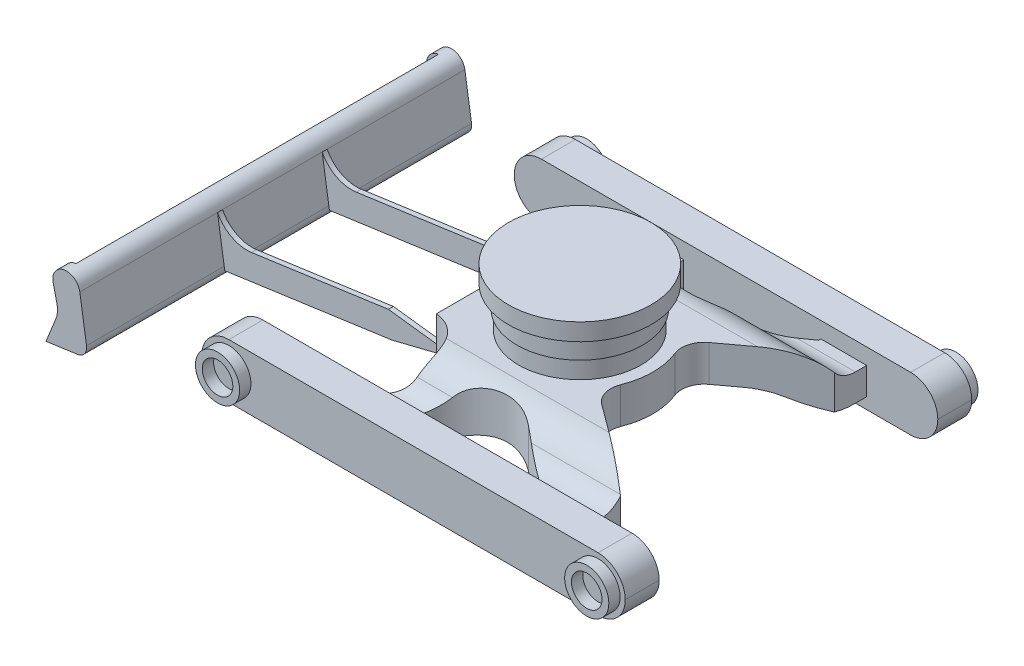
from build123d import *

# Parameters (mm, degrees)
BOSS_EXTRUDE1_DEPTH     = 125
CUT_EXTRUDE1_DEPTH      = 1988.3754049
CUT_EXTRUDE1_DEPTH_BACK = 1988.3754049
SKETCH2_OUTSIDE_W       = 1561.348
SKETCH2_OUTSIDE_H       = 581.348
BOSS_EXTRUDE2_START     = -162
SKETCH5_W               = 1870
SKETCH5_H               = 150
BOSS_EXTRUDE2_DEPTH     = 240
SKETCH6_R               = 97.5
SKETCH6_R_2             = 67.5
BOSS_EXTRUDE3_DEPTH     = 50
BOSS_EXTRUDE4_START     = 242
BOSS_EXTRUDE4_DEPTH     = 22
BOSS_EXTRUDE5_DEPTH     = 850
CUT_EXTRUDE2_DEPTH      = 800
FILLET1_R               = 120


with BuildPart() as part:
    # Sketch1 → Boss-Extrude1 (new, symmetric)
    with BuildSketch(Plane(origin=(0, 0, 0), x_dir=(1, 0, 0), z_dir=(0, 1, 0))):
        with BuildLine():
            Line((1556, 0), (1556, 143))
            Line((1556, 143), (1237.978629971, 378.323434848))
            ThreePointArc((1237.978629971, 378.323434848), (1201.290681935, 431.299496792), (1204.537119241, 495.657319277))
            ThreePointArc((1204.537119241, 495.657319277), (1227.393279461, 615), (1204.537119241, 734.342680723))
            ThreePointArc((1204.537119241, 734.342680723), (1201.290681935, 798.700503208), (1237.978629971, 851.676565152))
            Line((1237.978629971, 851.676565152), (1556, 1087))
            Line((1556, 1087), (1556, 1230))
            Line((1556, 1230), (1354, 1230))
            Line((1354, 1230), (1354, 1220))
            Line((1354, 1220), (1115.446796757, 1053.458774023))
            ThreePointArc((1115.446796757, 1053.458774023), (880.160611091, 1034.408386402), (748, 1230))
            Line((748, 1230), (490, 1230))
            Line((490, 1230), (490, 1220))
            ThreePointArc((490, 1220), (615.261987141, 1155.100386004), (665.520889463, 1023.280174895))
            ThreePointArc((665.520889463, 1023.280174895), (625.552350165, 919.777392468), (526.393279461, 870))
            Line((526.393279461, 870), (526.393279461, 360))
            ThreePointArc((526.393279461, 360), (625.552350165, 310.222607532), (665.520889463, 206.719825105))
            ThreePointArc((665.520889463, 206.719825105), (615.261987141, 74.899613996), (490, 10))
            Line((490, 10), (490, 0))
            Line((490, 0), (748, 0))
            ThreePointArc((748, 0), (880.160611091, 195.591613598), (1115.446796757, 176.541225977))
            Line((1115.446796757, 176.541225977), (1354, 10))
            Line((1354, 10), (1354, 0))
            Line((1354, 0), (1556, 0))
        make_face()
    extrude(amount=BOSS_EXTRUDE1_DEPTH, both=True)

    # Sketch2 outside → Cut-Extrude1 (cut, two sides: drawn at the far end of the back side and taken through both)
    with BuildSketch(Plane(origin=(0, 0, 0), x_dir=(0, 0, -1), z_dir=(1, 0, 0)).offset(-CUT_EXTRUDE1_DEPTH_BACK)):
        with Locations((615, 0)):
            Rectangle(SKETCH2_OUTSIDE_W, SKETCH2_OUTSIDE_H)
        with BuildLine():
            Line((287.306532047, 125), (942.693467953, 125))
            ThreePointArc((942.693467953, 125), (1021.812259611, 106.449731284), (1084.440322666, 54.665357377))
            ThreePointArc((1084.440322666, 54.665357377), (1126.66148877, 19.754543507), (1180, 7.248744372))
            Line((1180, 7.248744372), (1230, 7.248744372))
            Line((1230, 7.248744372), (1230, -112.751255628))
            Line((1230, -112.751255628), (1180, -112.751255628))
            ThreePointArc((1180, -112.751255628), (1082.973302732, -98.699147857), (993.919878018, -57.697571519))
            ThreePointArc((993.919878018, -57.697571519), (957.204869584, -40.793412853), (917.202634745, -35))
            Line((917.202634745, -35), (312.797365255, -35))
            ThreePointArc((312.797365255, -35), (272.795130416, -40.793412853), (236.080121982, -57.697571519))
            ThreePointArc((236.080121982, -57.697571519), (147.026697268, -98.699147857), (50, -112.751255628))
            Line((50, -112.751255628), (0, -112.751255628))
            Line((0, -112.751255628), (0, 7.248744372))
            Line((0, 7.248744372), (50, 7.248744372))
            ThreePointArc((50, 7.248744372), (103.33851123, 19.754543507), (145.559677334, 54.665357377))
            ThreePointArc((145.559677334, 54.665357377), (208.187740389, 106.449731284), (287.306532047, 125))
        make_face(mode=Mode.SUBTRACT)
    extrude(amount=CUT_EXTRUDE1_DEPTH + CUT_EXTRUDE1_DEPTH_BACK, mode=Mode.SUBTRACT)

    # Sketch4 → Revolve2 (revolve)
    with BuildSketch(Plane.XY.offset(-615), mode=Mode.PRIVATE) as revolve2_sk:
        Polygon((634.393279461, 125), (634.393279461, 205), (626.893279461, 205), (626.893279461, 285), (634.393279461, 285), (634.393279461, 302), (589.393279461, 302), (589.393279461, 378), (904.393279461, 378), (904.393279461, 125), align=None)
    revolve(revolve2_sk.sketch.rotate(Axis((904.393279461, 125, -615), (0, 1, 0)), 270), axis=Axis((904.393279461, 125, -615), (0, 1, 0)))

    # Sketch5 → Boss-Extrude2 (add)
    with BuildSketch(Plane(origin=(0, 0, 0), x_dir=(1, 0, 0), z_dir=(0, 1, 0)).offset(BOSS_EXTRUDE2_START)):
        with Locations((935, -75)):
            Rectangle(SKETCH5_W, SKETCH5_H)
    extrude(amount=BOSS_EXTRUDE2_DEPTH)

    # Sketch6 → Boss-Extrude3 (add)
    # profile 1 of 2: a face of its own
    with BuildSketch(Plane.XY.offset(150)):
        with Locations(Location((120, -42, 0), (0, 0, 180))):
            Circle(SKETCH6_R)
        with Locations((120, -42)):
            Circle(SKETCH6_R_2, mode=Mode.SUBTRACT)
    # profile 2 of 2: a face of its own
    with BuildSketch(Plane.XY.offset(150)):
        with Locations(Location((1750, -42, 0), (0, 0, 180))):
            Circle(SKETCH6_R)
        with Locations((1750, -42)):
            Circle(SKETCH6_R_2, mode=Mode.SUBTRACT)
    extrude(amount=BOSS_EXTRUDE3_DEPTH)

    # Mirror1: part across plane


with BuildPart() as part_1:
    add(part.part)
    add(part.part.mirror(Plane.XY.offset(-615)))

    # Sketch7 → Boss-Extrude4 (add)
    with BuildSketch(Plane.XY.offset(-615).offset(BOSS_EXTRUDE4_START)):
        with BuildLine():
            Line((526.393279461, -35), (316.739077686, -86.972258736))
            Line((316.739077686, -86.972258736), (-421.010633526, -190.656218952))
            Line((-421.010633526, -190.656218952), (-453.021781286, 15.931529197))
            ThreePointArc((-453.021781286, 15.931529197), (-390.355511274, -46.985943078), (-302.8250401, -61.955456452))
            Line((-302.8250401, -61.955456452), (301.29086348, 22.947496894))
            Line((301.29086348, 22.947496894), (526.393279461, -5))
            Line((526.393279461, -5), (526.393279461, -35))
        make_face()
    boss_extrude4 = extrude(amount=-BOSS_EXTRUDE4_DEPTH)

    # Mirror2: Boss-Extrude4 across plane
    add(boss_extrude4.mirror(Plane.XY.offset(-615)))

    # Sketch8 → Boss-Extrude5 (add, symmetric)
    with BuildSketch(Plane.XY.offset(-615)):
        with BuildLine():
            Line((-453.021781286, 15.931529197), (-423.475220037, -174.750716865))
            ThreePointArc((-423.475220037, -174.750716865), (-432.048100302, -209.407754251), (-462.745566226, -227.636031794))
            Line((-462.745566226, -227.636031794), (-602.373363919, -247.25943903))
            Line((-602.373363919, -247.25943903), (-558.742888614, -139.270223195))
            ThreePointArc((-558.742888614, -139.270223195), (-551.769540698, -109.655473426), (-554.024267593, -79.314458419))
            Line((-554.024267593, -79.314458419), (-570.776399854, -6.753001687))
            ThreePointArc((-570.776399854, -6.753001687), (-523.664054902, 65.660788419), (-453.021781286, 15.931529197))
        make_face()
    extrude(amount=BOSS_EXTRUDE5_DEPTH, both=True)

    # Sketch9 → Cut-Extrude2 (cut, symmetric)
    with BuildSketch(Plane.XY.offset(-615)):
        with BuildLine():
            Line((-593.289636782, -224.776425413), (-471.486664327, -207.658133995))
            Line((-471.486664327, -207.658133995), (-519.788760369, 66.276665137))
            ThreePointArc((-519.788760369, 66.276665137), (-561.510206091, 41.091588236), (-570.776399854, -6.753001687))
            Line((-570.776399854, -6.753001687), (-554.024267593, -79.314458419))
            ThreePointArc((-554.024267593, -79.314458419), (-551.769540698, -109.655473426), (-558.742888614, -139.270223195))
            Line((-558.742888614, -139.270223195), (-593.289636782, -224.776425413))
        make_face()
    extrude(amount=CUT_EXTRUDE2_DEPTH, both=True, mode=Mode.SUBTRACT)

    # Fillet1
    fillet1_edges = [part_1.edges().sort_by_distance(p)[0] for p in [
        (1870, -162, -1305),
        (1870, 78, -1305),
        (0, -162, -1305),
        (0, 78, -1305),
        (0, -162, 75),
        (0, 78, 75),
        (1870, -162, 75),
        (1870, 78, 75),
    ]]
    fillet(fillet1_edges, radius=FILLET1_R - 0.0001)  # a hair under: the kernel refuses the full size


solid = part_1.part
